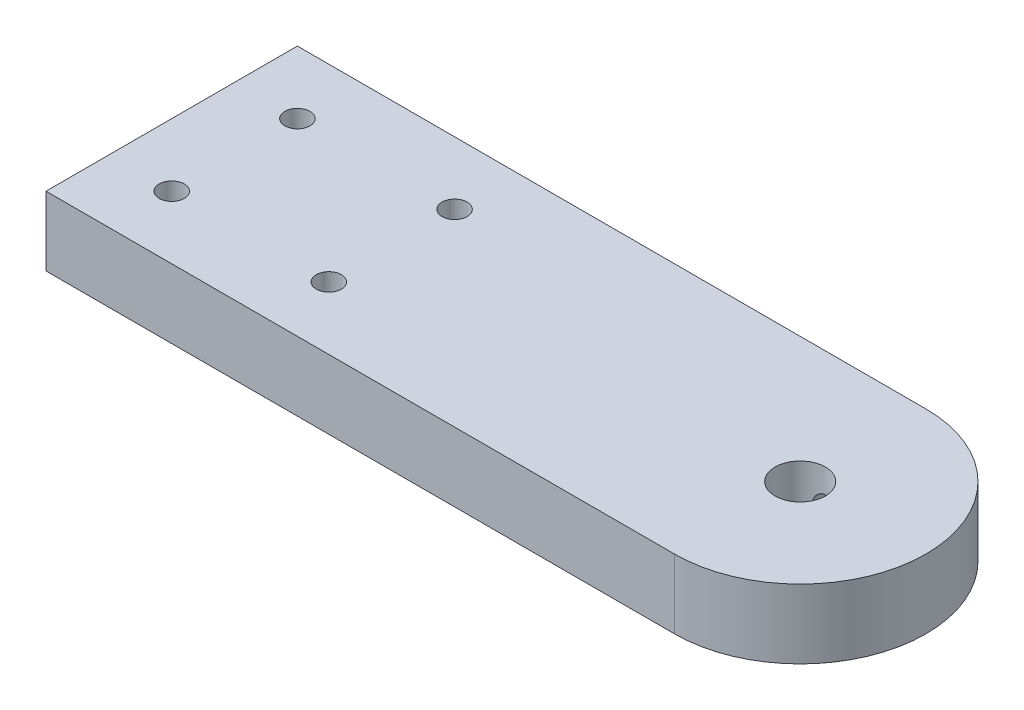
from build123d import *

# Parameters (mm, degrees)
SKETCH1_R             = 2
SKETCH1_R_2           = 4
BOSS_EXTRUDE1_DEPTH   = 11
M4_TAPPED_HOLE1_D     = 3.3
M4_TAPPED_HOLE1_DEPTH = 20
M4_TAPPED_HOLE1_TIP   = 0.991420021


with BuildPart() as part:
    # Sketch1 → Boss-Extrude1 (new body)
    with BuildSketch(Plane(origin=(0, 0, 0), x_dir=(1, 0, 0), z_dir=(0, 1, 0))):
        with BuildLine():
            Line((0, 20), (-100, 20))
            Line((-100, 20), (-100, -5))
            Line((-100, -5), (-100, -20))
            Line((-100, -20), (0, -20))
            ThreePointArc((0, -20), (14.142135607, -14.14213564), (20, -4.7e-08))
            ThreePointArc((20, -4.7e-08), (14.14213564, 14.142135607), (0, 20))
        make_face()
        with Locations((-90, -10)):
            Circle(SKETCH1_R, mode=Mode.SUBTRACT)
        with Locations((-65, -10)):
            Circle(SKETCH1_R, mode=Mode.SUBTRACT)
        with Locations((-90, 10)):
            Circle(SKETCH1_R, mode=Mode.SUBTRACT)
        with Locations((-65, 10)):
            Circle(SKETCH1_R, mode=Mode.SUBTRACT)
        Circle(SKETCH1_R_2, mode=Mode.SUBTRACT)
    extrude(amount=BOSS_EXTRUDE1_DEPTH)

    # M4 Tapped Hole1
    with Locations(Plane(origin=(0, 0, -20), x_dir=(-1, 0, 0), z_dir=(0, 0, -1))):
        with Locations((0, 5.5)):
            Hole(M4_TAPPED_HOLE1_D / 2, depth=M4_TAPPED_HOLE1_DEPTH)
            with Locations((0, 0, -(M4_TAPPED_HOLE1_DEPTH + M4_TAPPED_HOLE1_TIP / 2))):  # 118° drill point
                Cone(0, M4_TAPPED_HOLE1_D / 2, M4_TAPPED_HOLE1_TIP, mode=Mode.SUBTRACT)


solid = part.part
